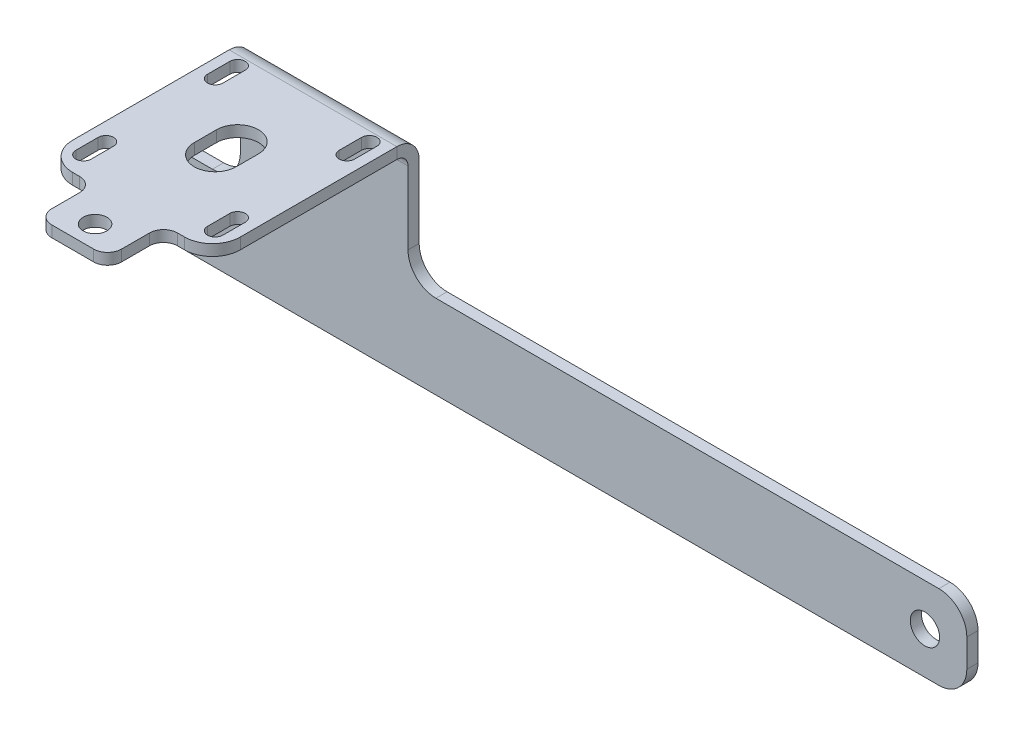
from build123d import *

# Parameters (mm, degrees)
SKETCH1_R                    = 4.25
BASE_FLANGE1_DEPTH           = 4
EDGE_FLANGE1_STRIP_W         = 24
EDGE_FLANGE1_STRIP_H         = 4
EDGE_FLANGE1_STRIP_CUT_DEPTH = 60
EDGE_FLANGE1_DEPTH           = 60
SKETCH11_R                   = 5.25
TAB1_DEPTH                   = 4
FILLET2_R                    = 10


# Sheet-metal steps are written as plain solids
with BuildPart() as part:
    # Sketch1 → Base-Flange1 (new body)
    with BuildSketch(Plane(origin=(0, 0, 0), x_dir=(1, 0, 0), z_dir=(0, 1, 0))):
        with BuildLine():
            Line((30, -35), (17.5, -35))
            ThreePointArc((17.5, -35), (13.964466094, -36.464466094), (12.5, -40))
            Line((12.5, -40), (12.5, -50))
            ThreePointArc((12.5, -50), (11.035533906, -53.535533906), (7.5, -55))
            Line((7.5, -55), (-7.5, -55))
            ThreePointArc((-7.5, -55), (-11.035533906, -53.535533906), (-12.5, -50))
            Line((-12.5, -50), (-12.5, -40))
            ThreePointArc((-12.5, -40), (-13.964466094, -36.464466094), (-17.5, -35))
            Line((-17.5, -35), (-30, -35))
            Line((-30, -35), (-30, 35))
            Line((-30, 35), (30, 35))
            Line((30, 35), (30, -35))
        make_face()
        with Locations(Location((0, -47, 0), (0, 0, 270))):
            Circle(SKETCH1_R, mode=Mode.SUBTRACT)
        with BuildLine():
            Line((-26.32, 19.57), (-26.32, 27.57))
            ThreePointArc((-26.32, 27.57), (-23.57, 30.32), (-20.82, 27.57))
            Line((-20.82, 27.57), (-20.82, 19.57))
            ThreePointArc((-20.82, 19.57), (-23.57, 16.82), (-26.32, 19.57))
        make_face(mode=Mode.SUBTRACT)
        with BuildLine():
            Line((26.32, 19.57), (26.32, 27.57))
            ThreePointArc((26.32, 27.57), (23.57, 30.32), (20.82, 27.57))
            Line((20.82, 27.57), (20.82, 19.57))
            ThreePointArc((20.82, 19.57), (23.57, 16.82), (26.32, 19.57))
        make_face(mode=Mode.SUBTRACT)
        with BuildLine():
            Line((26.32, -27.57), (26.32, -19.57))
            ThreePointArc((26.32, -19.57), (23.57, -16.82), (20.82, -19.57))
            Line((20.82, -19.57), (20.82, -27.57))
            ThreePointArc((20.82, -27.57), (23.57, -30.32), (26.32, -27.57))
        make_face(mode=Mode.SUBTRACT)
        with BuildLine():
            Line((-20.82, -27.57), (-20.82, -19.57))
            ThreePointArc((-20.82, -19.57), (-23.57, -16.82), (-26.32, -19.57))
            Line((-26.32, -19.57), (-26.32, -27.57))
            ThreePointArc((-26.32, -27.57), (-23.57, -30.32), (-20.82, -27.57))
        make_face(mode=Mode.SUBTRACT)
        with BuildLine():
            Line((7.5, 4), (7.5, -4))
            ThreePointArc((7.5, -4), (0, -11.5), (-7.5, -4))
            Line((-7.5, -4), (-7.5, 4))
            ThreePointArc((-7.5, 4), (0, 11.5), (7.5, 4))
        make_face(mode=Mode.SUBTRACT)
    extrude(amount=-BASE_FLANGE1_DEPTH)

    # Edge-Flange1 strip (across the edge) → Edge-Flange1 strip cut (cut)
    with BuildSketch(Plane(origin=(-30, -4, -35), x_dir=(0, 0, 1), z_dir=(1, 0, 0))):
        with Locations((-8, -2)):
            Rectangle(EDGE_FLANGE1_STRIP_W, EDGE_FLANGE1_STRIP_H)
    extrude(amount=EDGE_FLANGE1_STRIP_CUT_DEPTH, mode=Mode.SUBTRACT)

    # Edge-Flange1 section (across the edge) → Edge-Flange1 (add)
    with BuildSketch(Plane(origin=(-30, -4, -35), x_dir=(0, 0, 1), z_dir=(1, 0, 0))):
        with BuildLine():
            Line((-4, 4), (-4, 40))
            Line((-4, 40), (0, 40))
            Line((0, 40), (0, 4))
            ThreePointArc((0, 4), (1.171572875, 1.171572875), (4, 0))
            Line((4, 0), (4, -4))
            ThreePointArc((4, -4), (-1.656854249, -1.656854249), (-4, 4))
        make_face()
    extrude(amount=EDGE_FLANGE1_DEPTH)

    # Sketch11 → Tab1 (add)
    with BuildSketch(Plane(origin=(0, 0, -39), x_dir=(-1, 0, 0), z_dir=(0, 0, -1))):
        Polygon((-30, -44), (-230, -44), (-230, -74), (70, -74), (70, -44), (30, -44), (30, -8), (-30, -8), align=None)
        with Locations(Location((-215, -59, 0), (0, 0, 90))):
            Circle(SKETCH11_R, mode=Mode.SUBTRACT)
        with Locations(Location((55, -59, 0), (0, 0, 90))):
            Circle(SKETCH11_R, mode=Mode.SUBTRACT)
    extrude(amount=-TAB1_DEPTH)

    # Fillet2
    fillet2_edges = [part.edges().sort_by_distance(p)[0] for p in [
        (-30, -44, -37),
        (30, -44, -37),
        (-70, -44, -37),
        (-70, -74, -37),
        (230, -74, -37),
        (230, -44, -37),
        (30, -2, 35),
        (-30, -2, 35),
    ]]
    fillet(fillet2_edges, radius=FILLET2_R)


solid = part.part
